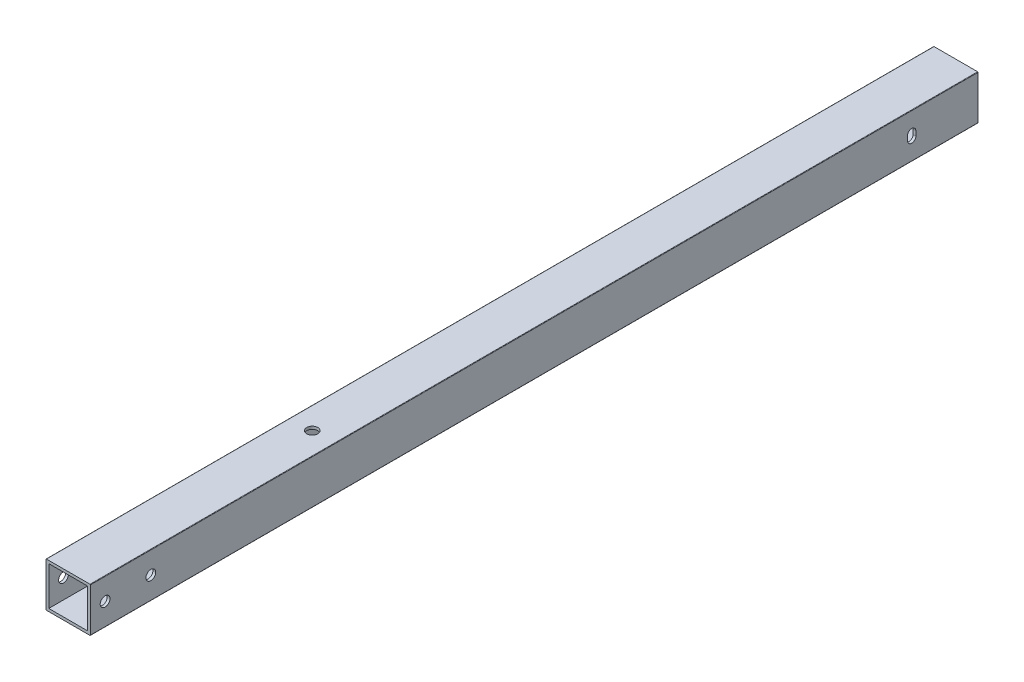
from build123d import *

# Parameters (mm, degrees)
SKETCH1_W           = 22.225
SKETCH1_H           = 22.225
BOSS_EXTRUDE1_DEPTH = 508
CUT_EXTRUDE2_DEPTH  = 510.191707666
SKETCH5_R           = 2.794
CUT_EXTRUDE3_DEPTH  = 25.4
SKETCH6_R           = 3.175
CUT_EXTRUDE4_DEPTH  = 510.191707666


with BuildPart() as part:
    # Sketch1 → Boss-Extrude1 (new body)
    with BuildSketch(Plane(origin=(0, 0, 0), x_dir=(-1, 0, 0), z_dir=(0, 0, -1))):
        with BuildLine():
            Line((1.5875, -1.3335), (1.5875, 23.5585))
            ThreePointArc((1.5875, 23.5585), (1.513105122, 23.738105122), (1.3335, 23.8125))
            Line((1.3335, 23.8125), (-23.5585, 23.8125))
            ThreePointArc((-23.5585, 23.8125), (-23.738105122, 23.738105122), (-23.8125, 23.5585))
            Line((-23.8125, 23.5585), (-23.8125, -1.3335))
            ThreePointArc((-23.8125, -1.3335), (-23.738105122, -1.513105122), (-23.5585, -1.5875))
            Line((-23.5585, -1.5875), (1.3335, -1.5875))
            ThreePointArc((1.3335, -1.5875), (1.513105122, -1.513105122), (1.5875, -1.3335))
        make_face()
        with Locations((-11.1125, 11.1125)):
            Rectangle(SKETCH1_W, SKETCH1_H, mode=Mode.SUBTRACT)
    extrude(amount=-BOSS_EXTRUDE1_DEPTH)

    # Sketch4 → Cut-Extrude2 (cut, through all)
    with BuildSketch(Plane(origin=(23.8125, 0, 0), x_dir=(0, 0, -1), z_dir=(1, 0, 0))):
        with BuildLine():
            ThreePointArc((-40.314518304, 9.8425), (-37.933268304, 7.46125), (-35.552018304, 9.8425))
            Line((-35.552018304, 9.8425), (-35.552018304, 12.3825))
            ThreePointArc((-35.552018304, 12.3825), (-37.933268304, 14.76375), (-40.314518304, 12.3825))
            Line((-40.314518304, 12.3825), (-40.314518304, 9.8425))
        make_face()
    extrude(amount=-CUT_EXTRUDE2_DEPTH, mode=Mode.SUBTRACT)

    # Sketch5 → Cut-Extrude3 (cut)
    with BuildSketch(Plane(origin=(23.8125, 0, 0), x_dir=(0, 0, -1), z_dir=(1, 0, 0))):
        with Locations((-499.577288815, 11.17096891)):
            Circle(SKETCH5_R)
        with Locations((-473.415288815, 11.17096891)):
            Circle(SKETCH5_R)
    extrude(amount=-CUT_EXTRUDE3_DEPTH, mode=Mode.SUBTRACT)

    # Sketch6 → Cut-Extrude4 (cut, through all)
    with BuildSketch(Plane.XZ.offset(1.5875)):
        with Locations((11.1125, 368.3)):
            Circle(SKETCH6_R)
    extrude(amount=-CUT_EXTRUDE4_DEPTH, mode=Mode.SUBTRACT)


solid = part.part
